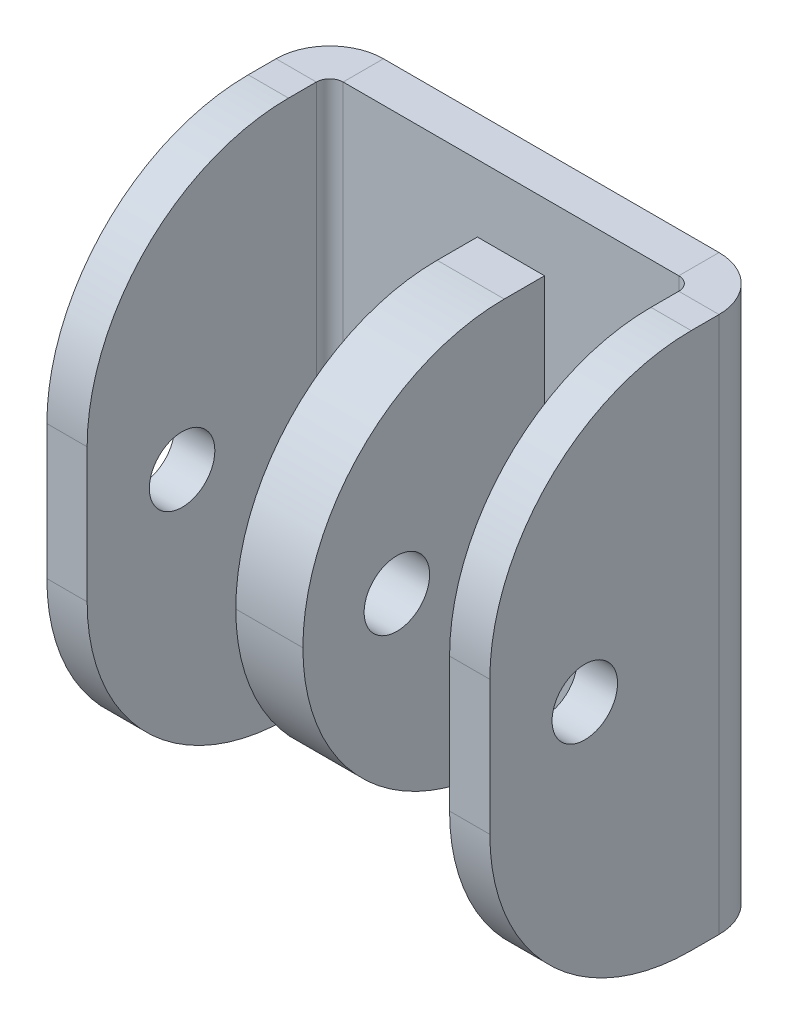
from build123d import *

# Parameters (mm, degrees)
SKETCH_2_W          = 67
SKETCH_2_H          = 40
EXTRUDE_1_DEPTH     = 3
OTHER_START         = -15.645963378
OTHER_1_DEPTH       = 40
OTHER_1_2_DEPTH     = 40
SKETCH_8_W          = 5
SKETCH_8_H          = 30
EXTRUDE_2_DEPTH     = 18
FILLET_2_R          = 15
FILLET_3_R          = 15
SKETCH_9_R          = 2.44
CUT_EXTRUDE_1_DEPTH = 43


# Read off the part's stored shape, not the designer's step: 绘制的折弯1
with BuildPart() as part:
    # Sketch 2 → 凸台-拉伸1 (new body)
    with BuildSketch(Plane.XY):
        with Locations((-0.762466526, 4.354036622)):
            Rectangle(SKETCH_2_W, SKETCH_2_H)
    extrude(amount=EXTRUDE_1_DEPTH)

    # Other 1 outline → Other 1 (cut)
    with BuildSketch(Plane(origin=(0, 0, 0), x_dir=(1, 0, 0), z_dir=(0, 1, 0)).offset(OTHER_START)):
        with BuildLine():
            Line((-34.262466526, -3), (-17.135449872, -3))
            ThreePointArc((-17.135449872, -3), (-15.711956269, -0.83772234), (-13.262466526, 0))
            Line((-13.262466526, 0), (-34.262466526, 0))
            Line((-34.262466526, 0), (-34.262466526, -3))
        make_face()
        with BuildLine():
            ThreePointArc((11.737533474, 0), (14.187023217, -0.83772234), (15.61051682, -3))
            Line((15.61051682, -3), (32.737533474, -3))
            Line((32.737533474, -3), (32.737533474, 0))
            Line((32.737533474, 0), (11.737533474, 0))
        make_face()
    extrude(amount=OTHER_1_DEPTH, mode=Mode.SUBTRACT)

    # Other 1 2 outline → Other 1 2 (add)
    with BuildSketch(Plane(origin=(0, 0, 0), x_dir=(1, 0, 0), z_dir=(0, 1, 0)).offset(OTHER_START)):
        with BuildLine():
            Line((-14.262466526, -21.073009183), (-14.262466526, -4))
            ThreePointArc((-14.262466526, -4), (-13.969573307, -3.292893219), (-13.262466526, -3))
            Line((-13.262466526, -3), (-17.135449872, -3))
            ThreePointArc((-17.135449872, -3), (-17.230585311, -3.49598283), (-17.262466526, -4))
            Line((-17.262466526, -4), (-17.262466526, -21.073009183))
            Line((-17.262466526, -21.073009183), (-14.262466526, -21.073009183))
        make_face()
        with BuildLine():
            Line((15.61051682, -3), (11.737533474, -3))
            ThreePointArc((11.737533474, -3), (12.444640255, -3.292893219), (12.737533474, -4))
            Line((12.737533474, -4), (12.737533474, -21.073009183))
            Line((12.737533474, -21.073009183), (15.737533474, -21.073009183))
            Line((15.737533474, -21.073009183), (15.737533474, -4))
            ThreePointArc((15.737533474, -4), (15.705652259, -3.49598283), (15.61051682, -3))
        make_face()
    extrude(amount=OTHER_1_2_DEPTH)

    # 草图8 → 凸台-拉伸2 (add)
    with BuildSketch(Plane.XY.offset(3)):
        with Locations((-0.762466526, 4.354036622)):
            Rectangle(SKETCH_8_W, SKETCH_8_H)
    extrude(amount=EXTRUDE_2_DEPTH)

    # 圆角2
    fillet_2_edges = [part.edges().sort_by_distance(p)[0] for p in [
        (-15.762466526, 24.354036622, 21.073009183),
    ]]
    fillet(fillet_2_edges, radius=FILLET_2_R)

    # 圆角3
    fillet_3_edges = [part.edges().sort_by_distance(p)[0] for p in [
        (14.237533474, -15.645963378, 21.073009183),
        (14.237533474, 24.354036622, 21.073009183),
        (-0.762466526, 19.354036622, 21),
        (-0.762466526, -10.645963378, 21),
        (-15.762466526, -15.645963378, 21.073009183),
    ]]
    fillet(fillet_3_edges, radius=FILLET_3_R - 0.0001)  # a hair under: the kernel refuses the full size

    # 草图9 → 切除-拉伸1 (cut)
    with BuildSketch(Plane(origin=(15.737533474, 0, 0), x_dir=(0, 0, -1), z_dir=(1, 0, 0))):
        with Locations(Location((-14, 4.354036622, 0), (0, 0, 90))):
            Circle(SKETCH_9_R)
    extrude(amount=-CUT_EXTRUDE_1_DEPTH, mode=Mode.SUBTRACT)


solid = part.part
